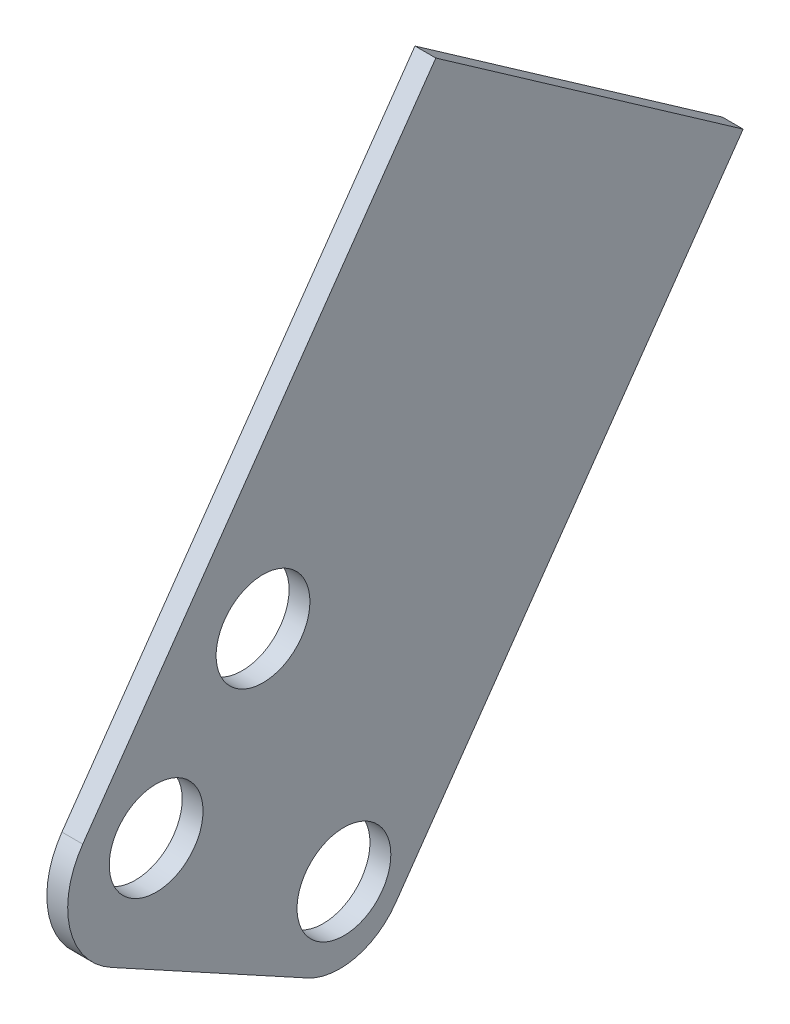
from build123d import *

# Parameters (mm, degrees)
BOSS_EXTRUDE2_DEPTH      = 3.175
BOSS_EXTRUDE2_DEPTH_BACK = 3.175
SKETCH1_R                = 14.2875


with BuildPart() as part:
    # Sketch1 → Boss-Extrude2 (new, two sides: drawn at the far end of the back side and taken through both)
    with BuildSketch(Plane(origin=(0, 0, 0), x_dir=(0, 0, -1), z_dir=(1, 0, 0)).offset(-BOSS_EXTRUDE2_DEPTH_BACK)):
        with BuildLine():
            Line((10.594785966, 15.13092246), (116.550731867, 166.4516954))
            Line((116.550731867, 166.4516954), (22.921653204, 232.011482074))
            Line((22.921653204, 232.011482074), (-84.6362425, 78.402887714))
            ThreePointArc((-84.6362425, 78.402887714), (-88.561708566, 58.046841565), (-76.011825816, 41.54598275))
            Line((-76.011825816, 41.54598275), (-16.208376106, 8.859054586))
            ThreePointArc((-16.208376106, 8.859054586), (-1.608360556, 6.873414672), (10.594785966, 15.13092246))
        make_face()
        with Locations((-62.285836902, 68.806748098)):
            Circle(SKETCH1_R, mode=Mode.SUBTRACT)
        with Locations((-5.068066609, 28.742434019)):
            Circle(SKETCH1_R, mode=Mode.SUBTRACT)
        with Locations((-29.716861807, 107.792666854)):
            Circle(SKETCH1_R, mode=Mode.SUBTRACT)
    extrude(amount=BOSS_EXTRUDE2_DEPTH + BOSS_EXTRUDE2_DEPTH_BACK)


solid = part.part
